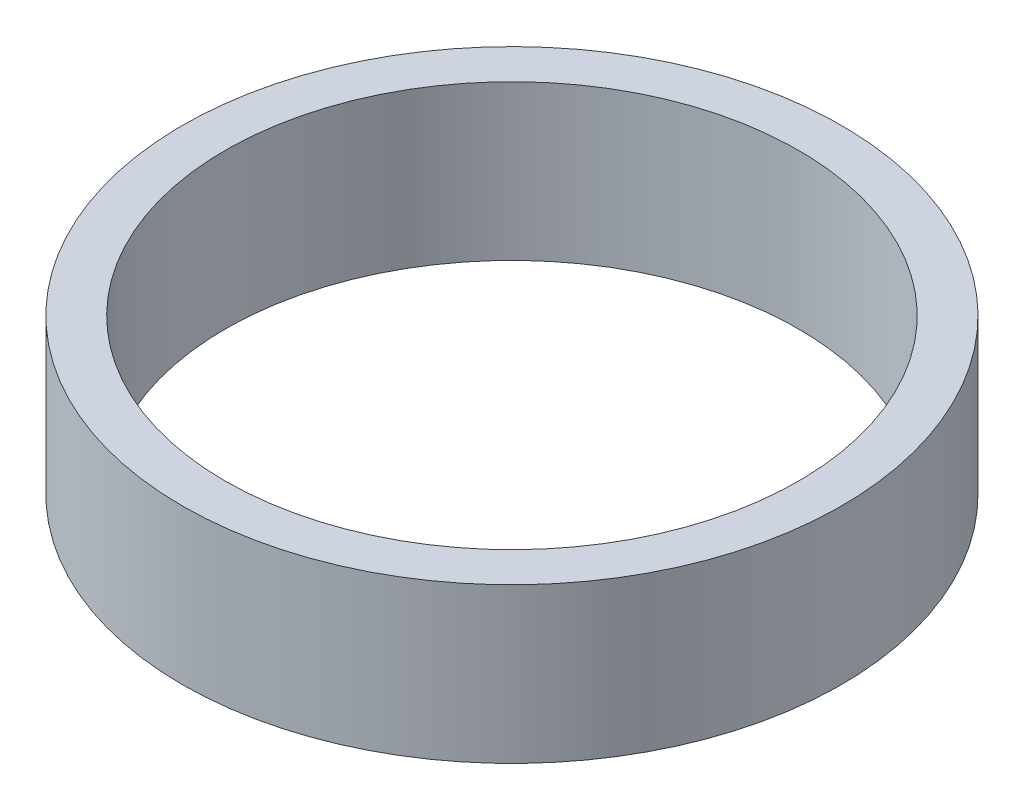
from build123d import *

# Parameters (mm, degrees)
SKETCH1_R           = 57.5
BOSS_EXTRUDE1_DEPTH = 27
SKETCH2_R           = 50
CUT_EXTRUDE1_DEPTH  = 86.68255365


with BuildPart() as part:
    # Sketch1 → Boss-Extrude1 (new body)
    with BuildSketch(Plane(origin=(0, 0, 0), x_dir=(1, 0, 0), z_dir=(0, 1, 0))):
        Circle(SKETCH1_R)
    extrude(amount=BOSS_EXTRUDE1_DEPTH)

    # Sketch2 → Cut-Extrude1 (cut, through all)
    with BuildSketch(Plane(origin=(0, 0, 0), x_dir=(1, 0, 0), z_dir=(0, 1, 0))):
        Circle(SKETCH2_R)
    extrude(amount=CUT_EXTRUDE1_DEPTH, mode=Mode.SUBTRACT)


solid = part.part
